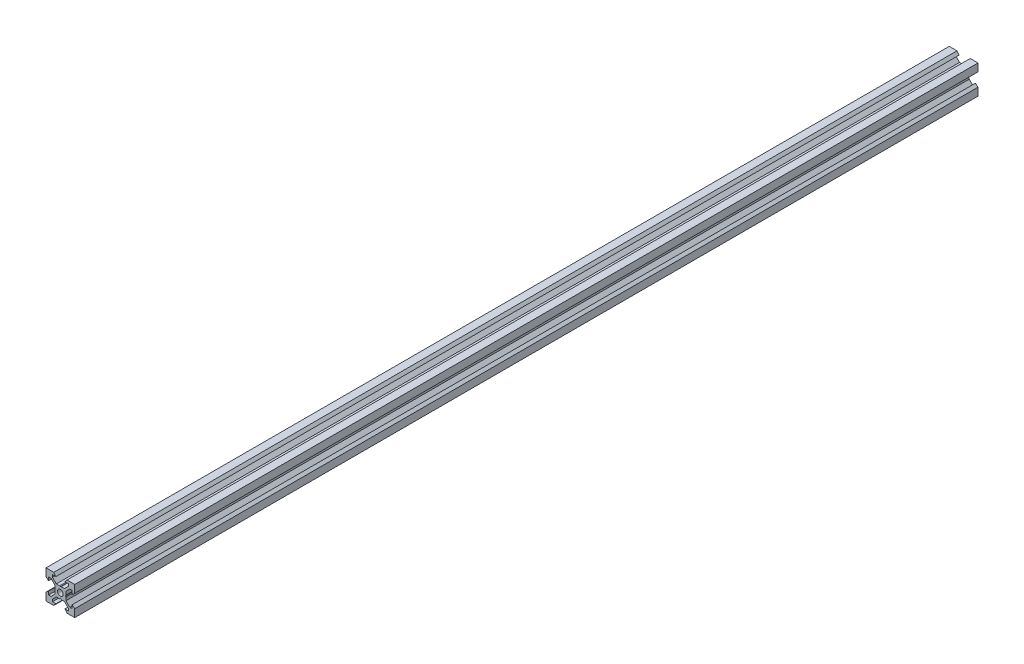
from build123d import *

# Parameters (mm, degrees)
SKETCH1_R           = 2
BOSS_EXTRUDE1_DEPTH = 314.19


with BuildPart() as part:
    # Sketch1 → Boss-Extrude1 (new, symmetric)
    with BuildSketch(Plane.XY):
        Polygon((10, 4.610379336), (10, 10), (4.610379336, 10), (3.1, 8.2), (5.5, 8.2), (5.5, 6.560660172), (2.839339828, 3.9), (0.519615242, 3.9), (0, 3.6), (-0.519615242, 3.9), (-2.839339828, 3.9), (-5.5, 6.560660172), (-5.5, 8.2), (-3.1, 8.2), (-4.610379336, 10), (-10, 10), (-10, 4.610379336), (-8.2, 3.1), (-8.2, 5.5), (-6.560660172, 5.5), (-3.9, 2.839339828), (-3.9, 0.519615242), (-3.6, 0), (-3.9, -0.519615242), (-3.9, -2.839339828), (-6.560660172, -5.5), (-8.2, -5.5), (-8.2, -3.1), (-10, -4.610379336), (-10, -10), (-4.610379336, -10), (-3.1, -8.2), (-5.5, -8.2), (-5.5, -6.560660172), (-2.839339828, -3.9), (-0.519615242, -3.9), (0, -3.6), (0.519615242, -3.9), (2.839339828, -3.9), (5.5, -6.560660172), (5.5, -8.2), (3.1, -8.2), (4.610379336, -10), (10, -10), (10, -4.610379336), (8.2, -3.1), (8.2, -5.5), (6.560660172, -5.5), (3.9, -2.839339828), (3.9, -0.519615242), (3.6, 0), (3.9, 0.519615242), (3.9, 2.839339828), (6.560660172, 5.5), (8.2, 5.5), (8.2, 3.1), align=None)
        Circle(SKETCH1_R, mode=Mode.SUBTRACT)
    extrude(amount=BOSS_EXTRUDE1_DEPTH, both=True)


solid = part.part
